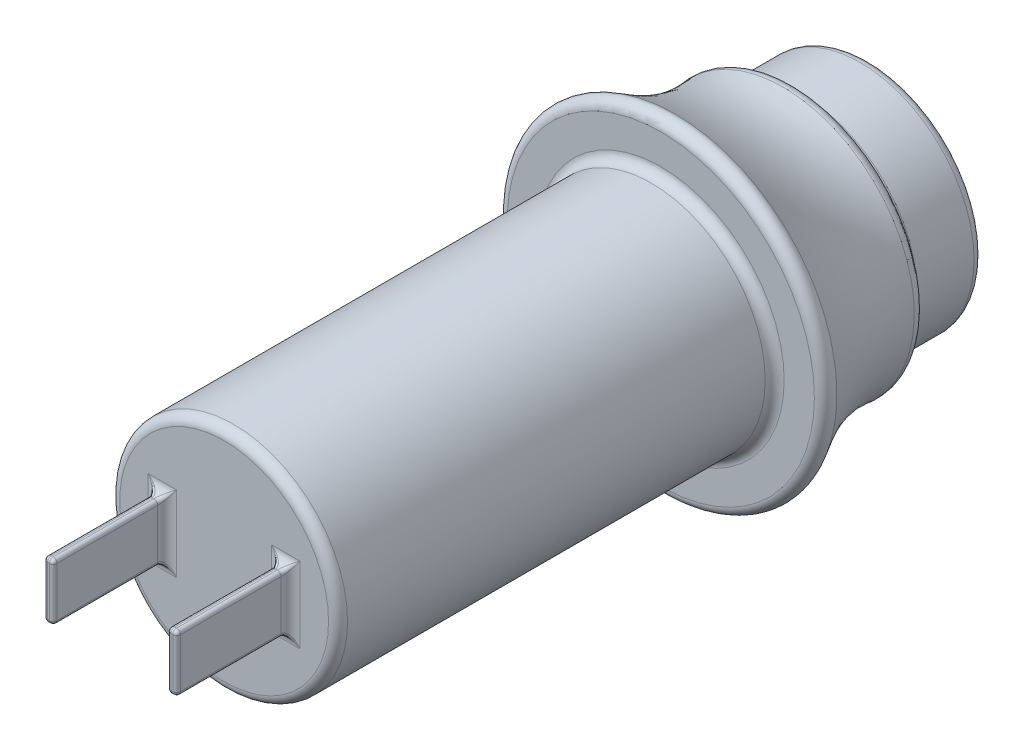
from build123d import *

# Parameters (mm, degrees)
SKETCH1_R           = 6
BOSS_EXTRUDE1_DEPTH = 4
SKETCH4_R           = 6
BOSS_EXTRUDE2_DEPTH = 23
SKETCH5_W           = 0.5
SKETCH5_H           = 3
BOSS_EXTRUDE3_DEPTH = 6
FILLET1_R           = 0.5
FILLET2_R           = 0.5
FILLET3_R           = 0.5
FILLET4_R           = 0.5
FILLET5_R           = 0.5
FILLET6_R           = 0.2


with BuildPart() as part:
    # Sketch1 → Boss-Extrude1 (new body)
    with BuildSketch(Plane.XY):
        Circle(SKETCH1_R)
    extrude(amount=BOSS_EXTRUDE1_DEPTH)

    # Loft1: read off the stored shape, not the designer's step
    # Loft1: loft between two sections, ruled curve by curve
    loft1_from = [
        Edge.make_bspline([(-8.593780903, 2.673374234, 11), (-3.247032434, 19.86093604, 11), (13.940529371, 14.514187571, 11), (8.593780903, -2.673374234, 11), (3.247032434, -19.86093604, 11), (-13.940529371, -14.514187571, 11), (-8.593780903, 2.673374234, 11)], [0, 0, 0, 0, 0.5, 0.5, 0.5, 1, 1, 1, 1], 3, [1, 0.333333333, 0.333333333, 1, 0.333333333, 0.333333333, 1]),
    ]
    loft1_to = [
        Edge.make_bspline([(-2.507206891, 6.535588237, 4), (10.563969583, 11.55000202, 4), (15.578383365, -1.521174454, 4), (2.507206891, -6.535588237, 4), (-10.563969583, -11.55000202, 4), (-15.578383365, 1.521174454, 4), (-2.507206891, 6.535588237, 4)], [0, 0, 0, 0, 0.5, 0.5, 0.5, 1, 1, 1, 1], 3, [1, 0.333333333, 0.333333333, 1, 0.333333333, 0.333333333, 1]),
    ]
    loft1 = Solid(Shell([*[Face.make_surface_from_curves(loft1_from[k], loft1_to[k]) for k in range(1)], Face(Wire(loft1_from)), Face(Wire(loft1_to))]))
    add(loft1)

    # Sketch4 → Boss-Extrude2 (add)
    with BuildSketch(Plane.XY.offset(11)):
        Circle(SKETCH4_R)
    extrude(amount=BOSS_EXTRUDE2_DEPTH)

    # Sketch5 → Boss-Extrude3 (add)
    with BuildSketch(Plane.XY.offset(34)):
        with Locations((-3.25, 0)):
            Rectangle(SKETCH5_W, SKETCH5_H)
        with Locations((3.25, 0)):
            Rectangle(SKETCH5_W, SKETCH5_H)
    extrude(amount=BOSS_EXTRUDE3_DEPTH)

    # Fillet1
    fillet1_edges = [part.edges().sort_by_distance(p)[0] for p in [
        (-6, 0, 0),
        (8.593780903, -2.673374234, 11),
        (2.507206891, -6.535588237, 4),
    ]]
    fillet(fillet1_edges, radius=FILLET1_R)

    # Fillet2
    fillet2_edges = [part.edges().sort_by_distance(p)[0] for p in [
        (-6, 0, 4),
    ]]
    fillet(fillet2_edges, radius=FILLET2_R)

    # Fillet3
    fillet3_edges = [part.edges().sort_by_distance(p)[0] for p in [
        (-6, 0, 11),
        (-6, 0, 34),
    ]]
    fillet(fillet3_edges, radius=FILLET3_R)

    # Fillet4
    fillet4_edges = [part.edges().sort_by_distance(p)[0] for p in [
        (3.25, 1.5, 34),
        (3, 0, 34),
        (3.25, -1.5, 34),
        (3.5, 0, 34),
    ]]
    fillet(fillet4_edges, radius=FILLET4_R)

    # Fillet5
    fillet5_edges = [part.edges().sort_by_distance(p)[0] for p in [
        (-3.5, 0, 34),
        (-3.25, -1.5, 34),
        (-3, 0, 34),
        (-3.25, 1.5, 34),
    ]]
    fillet(fillet5_edges, radius=FILLET5_R)

    # Fillet6
    fillet6_edges = [part.edges().sort_by_distance(p)[0] for p in [
        (-3.5, 1.5, 37.25),
        (-3.5, -1.5, 37.25),
        (-3, -1.5, 37.25),
        (-3, 1.5, 37.25),
        (-3.5, 0, 40),
        (-3.25, -1.5, 40),
        (-3, 0, 40),
        (-3.25, 1.5, 40),
        (3.5, 1.5, 37.25),
        (3, 1.5, 37.25),
        (3, -1.5, 37.25),
        (3.5, -1.5, 37.25),
        (3.25, 1.5, 40),
        (3, 0, 40),
        (3.25, -1.5, 40),
        (3.5, 0, 40),
        (2.823024454, 1.676975546, 34.118351992),
        (3.676975546, 1.676975546, 34.118351992),
        (2.823024454, -1.676975546, 34.118351992),
        (3.676975546, -1.676975546, 34.118351992),
        (-3.676975546, -1.676975546, 34.118351992),
        (-3.676975546, 1.676975546, 34.118351992),
        (-2.823024454, -1.676975546, 34.118351992),
        (-2.823024454, 1.676975546, 34.118351992),
    ]]
    fillet(fillet6_edges, radius=FILLET6_R)


solid = part.part
